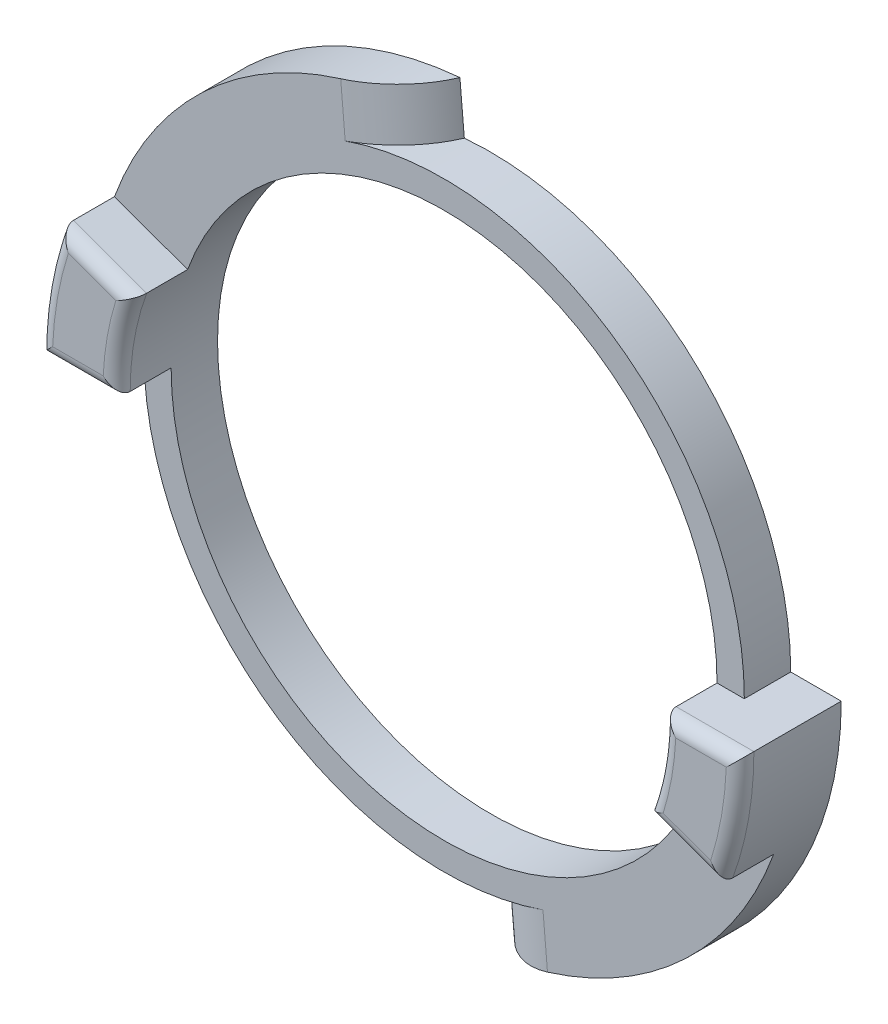
from build123d import *

# Parameters (mm, degrees)
BOSS_EXTRUDE1_DEPTH = 1.7
FILLET1_R           = 3
BOSS_EXTRUDE2_DEPTH = 2
FILLET2_R           = 0.5


with BuildPart() as part:
    # Sketch1 → Boss-Extrude1 (new body)
    with BuildSketch(Plane.XY):
        with BuildLine():
            ThreePointArc((-11, 0), (-8.110050705, 7.431492284), (-0.95871317, 10.958141679))
            Line((-0.95871317, 10.958141679), (-1.119951294, 12.80110187))
            ThreePointArc((-1.119951294, 12.80110187), (-9.474013778, 8.681334168), (-12.85, 0))
            Line((-12.85, 0), (-11, 0))
        make_face()
        with BuildLine():
            ThreePointArc((-10, 0), (-7.372773368, 6.755902076), (-0.871557427, 9.961946981))
            Line((-0.871557427, 9.961946981), (-0.95871317, 10.958141679))
            ThreePointArc((-0.95871317, 10.958141679), (-8.110050705, 7.431492284), (-11, 0))
            Line((-11, 0), (-10, 0))
        make_face()
        with BuildLine():
            Line((-0.95871317, 10.958141679), (-0.871557427, 9.961946981))
            ThreePointArc((-0.871557427, 9.961946981), (6.755902076, 7.372773368), (10, 0))
            Line((10, 0), (11, 0))
            ThreePointArc((11, 0), (7.431492284, 8.110050705), (-0.95871317, 10.958141679))
        make_face()
        with BuildLine():
            ThreePointArc((10, 0), (7.372773368, -6.755902076), (0.871557427, -9.961946981))
            Line((0.871557427, -9.961946981), (0.95871317, -10.958141679))
            ThreePointArc((0.95871317, -10.958141679), (8.110050705, -7.431492284), (11, 0))
            Line((11, 0), (10, 0))
        make_face()
        with BuildLine():
            Line((0.95871317, -10.958141679), (0.871557427, -9.961946981))
            ThreePointArc((0.871557427, -9.961946981), (-6.755902076, -7.372773368), (-10, 0))
            Line((-10, 0), (-11, 0))
            ThreePointArc((-11, 0), (-7.431492284, -8.110050705), (0.95871317, -10.958141679))
        make_face()
        with BuildLine():
            ThreePointArc((11, 0), (8.110050705, -7.431492284), (0.95871317, -10.958141679))
            Line((0.95871317, -10.958141679), (1.119951294, -12.80110187))
            ThreePointArc((1.119951294, -12.80110187), (9.474013778, -8.681334168), (12.85, 0))
            Line((12.85, 0), (11, 0))
        make_face()
    extrude(amount=BOSS_EXTRUDE1_DEPTH)

    # Fillet1
    # the kernel refuses this fillet: 3 mm, written as the material it takes off along each edge
    with BuildSketch(Plane(origin=(0.369605462, -4.22460976, 1.7), x_dir=(0.9961946980917454, 0.08715574274765832, 0), z_dir=(0.08715574274765833, -0.9961946980917455, 0))) as fillet1_piece_1_section:
        with BuildLine():
            CenterArc((2.703701167, -3), FILLET1_R, 90, 64.320711381)
            Line((0, -1.7), (0, 0))
            Line((0, 0), (2.703701167, 0))
        make_face()
    fillet1_piece_1 = extrude(amount=15.368505835, mode=Mode.PRIVATE)
    fillet1_piece_1 = fillet1_piece_1 - Plane(origin=(0, 0, 1.24476439), x_dir=(1, 0, 0), z_dir=(0, 0, -1)) * Cylinder(11, 42, mode=Mode.PRIVATE)
    add(fillet1_piece_1, mode=Mode.SUBTRACT)
    with BuildSketch(Plane(origin=(-1.709059003, 19.53463379, 1.7), x_dir=(0, 0, -1), z_dir=(0.08715574274761673, -0.9961946980917492, 0))) as fillet1_piece_2_section:
        with BuildLine():
            CenterArc((3, -2.703701167), FILLET1_R, 115.679288619, 64.320711381)
            Line((0, -2.703701167), (0, 0))
            Line((0, 0), (1.7, 0))
        make_face()
    fillet1_piece_2 = extrude(amount=15.368505835, mode=Mode.PRIVATE)
    fillet1_piece_2 = fillet1_piece_2 - Plane(origin=(0, 0, 1.24476439), x_dir=(1, 0, 0), z_dir=(0, 0, -1)) * Cylinder(11, 42, mode=Mode.PRIVATE)
    add(fillet1_piece_2, mode=Mode.SUBTRACT)

    # Sketch2 → Boss-Extrude2 (add)
    with BuildSketch(Plane.XY.offset(1.7)):
        with BuildLine():
            Line((-12.85, 0), (-11, 0))
            Line((-11, 0), (-10, 0))
            ThreePointArc((-10, 0), (-9.84807753, 1.736481777), (-9.396926208, 3.420201433))
            Line((-9.396926208, 3.420201433), (-12.075050177, 4.394958842))
            ThreePointArc((-12.075050177, 4.394958842), (-12.654779626, 2.231379083), (-12.85, 0))
        make_face()
        with BuildLine():
            ThreePointArc((10, 0), (9.84807753, -1.736481777), (9.396926208, -3.420201433))
            Line((9.396926208, -3.420201433), (12.075050177, -4.394958842))
            ThreePointArc((12.075050177, -4.394958842), (12.654779626, -2.231379083), (12.85, 0))
            Line((12.85, 0), (11, 0))
            Line((11, 0), (10, 0))
        make_face()
    extrude(amount=BOSS_EXTRUDE2_DEPTH)

    # Fillet2
    fillet2_edges = [part.edges().sort_by_distance(p)[0] for p in [
        (-9.84807753, 1.736481777, 3.7),
        (-10.735988192, 3.907580137, 3.7),
        (-12.654779626, 2.231379083, 3.7),
        (-11.425, 0, 3.7),
        (9.84807753, -1.736481777, 3.7),
        (10.735988192, -3.907580137, 3.7),
        (12.654779626, -2.231379083, 3.7),
        (11.425, 0, 3.7),
    ]]
    fillet(fillet2_edges, radius=FILLET2_R)


solid = part.part
